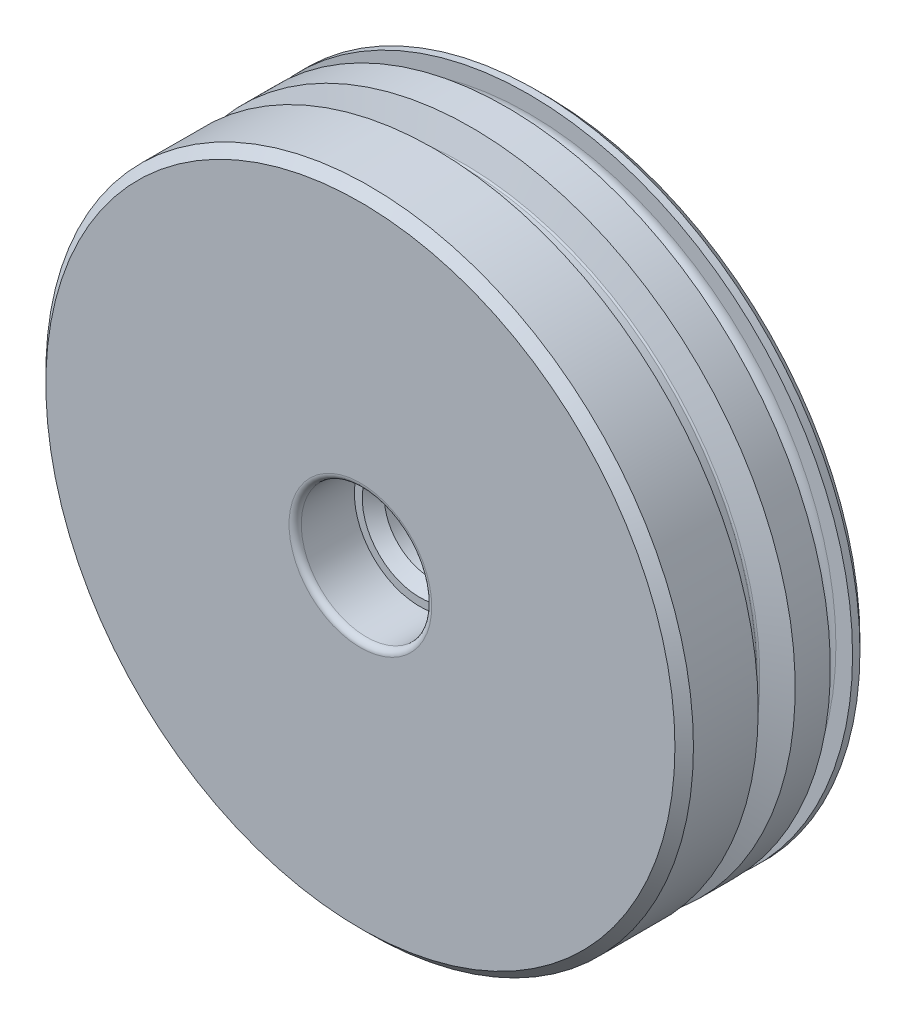
from build123d import *

# Parameters (mm, degrees)
BOSS_EXTRUDE1_DEPTH      = 5
BOSS_EXTRUDE1_DEPTH_BACK = 5
SKETCH1_R                = 17.5
SKETCH2_R                = 3.525
CUT_EXTRUDE1_DEPTH       = 3.2
CHAMFER1_SIZE            = 0.5
SKETCH4_R                = 2.5
CUT_EXTRUDE2_DEPTH       = 26.665930725
CHAMFER2_SIZE            = 0.6
CHAMFER2_OF_MIRROR2_SIZE = 0.6
FILLET1_R                = 0.33
SKETCH9_W                = 3.2
SKETCH9_H                = 3.2
CUT_EXTRUDE4_DEPTH       = 4


with BuildPart() as part:
    # Sketch1 → Boss-Extrude1 (new, two sides: drawn at the far end of the back side and taken through both)
    with BuildSketch(Plane.XY.offset(-BOSS_EXTRUDE1_DEPTH_BACK)):
        Circle(SKETCH1_R)
    extrude(amount=BOSS_EXTRUDE1_DEPTH + BOSS_EXTRUDE1_DEPTH_BACK)

    # Sketch3 → Cut-Revolve1 (revolve, cut)
    with BuildSketch(Plane(origin=(0, 0, 0), x_dir=(0, 0, -1), z_dir=(1, 0, 0))):
        with BuildLine():
            Line((-1, 17.5), (-0.522792408, 16.068377223))
            ThreePointArc((-0.522792408, 16.068377223), (-0.486395106, 16.018875781), (-0.427924078, 16))
            Line((-0.427924078, 16), (0.427924078, 16))
            ThreePointArc((0.427924078, 16), (0.486395106, 16.018875781), (0.522792408, 16.068377223))
            Line((0.522792408, 16.068377223), (1, 17.5))
            Line((1, 17.5), (-1, 17.5))
        make_face()
    revolve(axis=Axis((0, 0, -0.35), (0, 0, 1)), mode=Mode.SUBTRACT)

    # Sketch2 → Cut-Extrude1 (cut)
    with BuildSketch(Plane.XY.offset(5)):
        Circle(SKETCH2_R)
    cut_extrude1 = extrude(amount=-CUT_EXTRUDE1_DEPTH, mode=Mode.SUBTRACT)

    # Chamfer1
    chamfer1_edges = [part.edges().sort_by_distance(p)[0] for p in [
        (-17.5, 0, 5),
        (-17.5, 0, -5),
    ]]
    chamfer(chamfer1_edges, length=CHAMFER1_SIZE)

    # Sketch4 → Cut-Extrude2 (cut, through all)
    with BuildSketch(Plane.XY.offset(1.8)):
        Circle(SKETCH4_R)
    extrude(amount=-CUT_EXTRUDE2_DEPTH, mode=Mode.SUBTRACT)

    # Chamfer2
    chamfer2_edges = [part.edges().sort_by_distance(p)[0] for p in [
        (-2.5, 0, 1.8),
    ]]
    chamfer(chamfer2_edges, length=CHAMFER2_SIZE)

    # Mirror2: Cut-Extrude1 across plane
    add(cut_extrude1.mirror(Plane.XY), mode=Mode.SUBTRACT)

    # Chamfer2 of Mirror2
    chamfer2_of_mirror2_edges = [part.edges().sort_by_distance(p)[0] for p in [
        (-2.5, 0, -1.8),
    ]]
    chamfer(chamfer2_of_mirror2_edges, length=CHAMFER2_OF_MIRROR2_SIZE)

    # Sketch7 → Cut-Revolve3 (revolve, cut)
    with BuildSketch(Plane(origin=(0, 0, 0), x_dir=(0, 0, -1), z_dir=(1, 0, 0))):
        with BuildLine():
            Line((2.9, 16.6), (2.9, 17.5))
            Line((2.9, 17.5), (4.1, 17.5))
            Line((4.1, 17.5), (4.1, 16.6))
            ThreePointArc((4.1, 16.6), (3.5, 16), (2.9, 16.6))
        make_face()
    revolve(axis=Axis((0, 0, -0.35), (0, 0, 1)), mode=Mode.SUBTRACT)

    # Fillet1
    fillet1_edges = [part.edges().sort_by_distance(p)[0] for p in [
        (-3.525, 0, 5),
        (-3.525, 0, -5),
    ]]
    fillet(fillet1_edges, radius=FILLET1_R)

    # Sketch9 → Cut-Extrude4 (cut)
    with BuildSketch(Plane(origin=(0, 0, -5), x_dir=(-1, 0, 0), z_dir=(0, 0, -1))):
        with Locations((-6, 0)):
            Rectangle(SKETCH9_W, SKETCH9_H)
        with Locations((6, 0)):
            Rectangle(SKETCH9_W, SKETCH9_H)
    extrude(amount=-CUT_EXTRUDE4_DEPTH, mode=Mode.SUBTRACT)


solid = part.part
